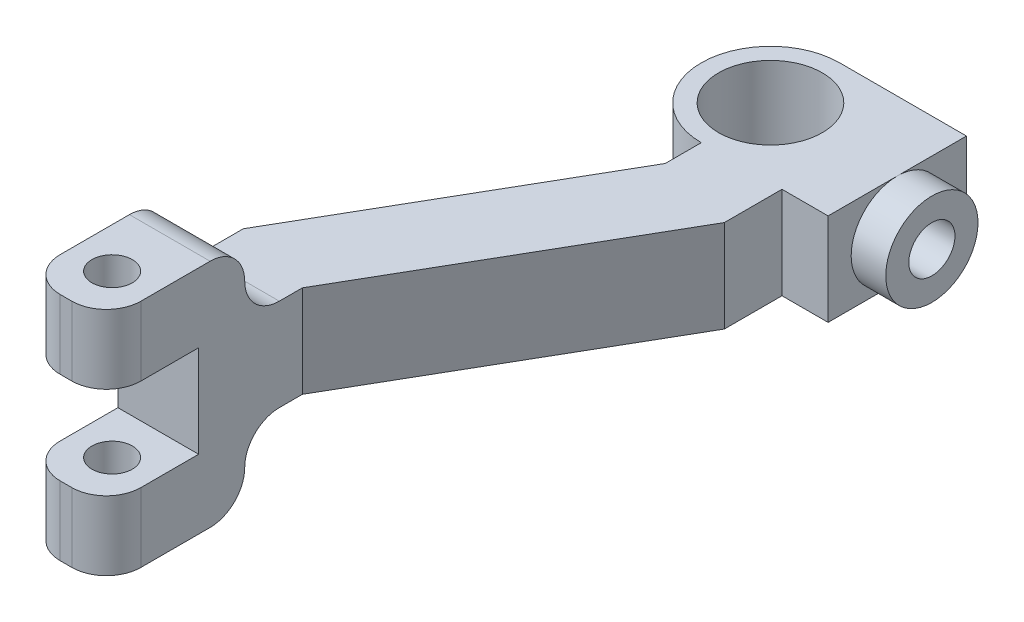
from build123d import *

# Parameters (mm, degrees)
SKETCH1_R           = 4.5
BOSS_EXTRUDE1_DEPTH = 8
SKETCH2_R           = 4
BOSS_EXTRUDE2_DEPTH = 3
SKETCH3_R           = 2
CUT_EXTRUDE1_DEPTH  = 5
BOSS_EXTRUDE3_DEPTH = 8
SKETCH5_W           = 7
SKETCH5_H           = 20
BOSS_EXTRUDE4_DEPTH = 12
FILLET1_START       = -13.395559342
FILLET1_DEPTH       = 7
FILLET1_2_DEPTH     = 7
SKETCH6_W           = 7
SKETCH6_H           = 8
CUT_EXTRUDE2_DEPTH  = 8
FILLET2_R           = 3
SKETCH7_R           = 1.75
CUT_EXTRUDE3_DEPTH  = 57.724097483


with BuildPart() as part:
    # Sketch1 → Boss-Extrude1 (new body)
    with BuildSketch(Plane(origin=(0, 0, 0), x_dir=(1, 0, 0), z_dir=(0, 1, 0))):
        with BuildLine():
            Line((0, 6), (11, 6))
            Line((11, 6), (11, -6))
            Line((11, -6), (0, -6))
            ThreePointArc((0, -6), (-6, 0), (0, 6))
        make_face()
        with Locations(Location((0, 0, 0), (0, 0, 270))):
            Circle(SKETCH1_R, mode=Mode.SUBTRACT)
    extrude(amount=BOSS_EXTRUDE1_DEPTH)

    # Sketch2 → Boss-Extrude2 (add)
    with BuildSketch(Plane(origin=(11, 0, 0), x_dir=(0, 0, -1), z_dir=(1, 0, 0))):
        with Locations(Location((0, 4, 0), (0, 0, 270))):
            Circle(SKETCH2_R)
    extrude(amount=BOSS_EXTRUDE2_DEPTH)

    # Sketch3 → Cut-Extrude1 (cut)
    with BuildSketch(Plane(origin=(14, 0, 0), x_dir=(0, 0, -1), z_dir=(1, 0, 0))):
        with Locations((0, 4)):
            Circle(SKETCH3_R)
    extrude(amount=-CUT_EXTRUDE1_DEPTH, mode=Mode.SUBTRACT)

    # Sketch4 → Boss-Extrude3 (add)
    with BuildSketch(Plane(origin=(0, 0, 0), x_dir=(1, 0, 0), z_dir=(0, 1, 0))):
        Polygon((0, -6), (0, -9.124355653), (-13.395559342, -32.326145029), (-13.395559342, -39.201789376), (-6.395559342, -39.201789376), (-6.395559342, -34.201789376), (7, -11), (7, -6), align=None)
    extrude(amount=BOSS_EXTRUDE3_DEPTH)

    # Sketch5 → Boss-Extrude4 (add)
    with BuildSketch(Plane.XY.offset(39.201789376)):
        with Locations((-9.895559342, 4)):
            Rectangle(SKETCH5_W, SKETCH5_H)
    extrude(amount=BOSS_EXTRUDE4_DEPTH)

    # Fillet1: read off the stored shape, not the designer's step
    # Fillet1 outline → Fillet1 (cut)
    with BuildSketch(Plane.YZ.offset(FILLET1_START)):
        with BuildLine():
            Line((-6, 39.201789376), (-3, 39.201789376))
            ThreePointArc((-3, 39.201789376), (-5.121320344, 40.080469032), (-6, 42.201789376))
            Line((-6, 42.201789376), (-6, 39.201789376))
        make_face()
        with BuildLine():
            ThreePointArc((14, 42.201789376), (13.121320344, 40.080469032), (11, 39.201789376))
            Line((11, 39.201789376), (14, 39.201789376))
            Line((14, 39.201789376), (14, 42.201789376))
        make_face()
    extrude(amount=FILLET1_DEPTH, mode=Mode.SUBTRACT)

    # Fillet1 2 outline → Fillet1 2 (add)
    with BuildSketch(Plane.YZ.offset(FILLET1_START)):
        with BuildLine():
            ThreePointArc((-3, 39.201789376), (-0.878679657, 38.32310972), (0, 36.201789376))
            Line((0, 36.201789376), (0, 39.201789376))
            Line((0, 39.201789376), (-3, 39.201789376))
        make_face()
        with BuildLine():
            ThreePointArc((8, 36.201789376), (8.878679656, 38.32310972), (11, 39.201789376))
            Line((11, 39.201789376), (8, 39.201789376))
            Line((8, 39.201789376), (8, 36.201789376))
        make_face()
    extrude(amount=FILLET1_2_DEPTH)

    # Sketch6 → Cut-Extrude2 (cut)
    with BuildSketch(Plane.XY.offset(51.201789376)):
        with Locations((-9.895559342, 4)):
            Rectangle(SKETCH6_W, SKETCH6_H)
    extrude(amount=-CUT_EXTRUDE2_DEPTH, mode=Mode.SUBTRACT)

    # Fillet2
    fillet2_edges = [part.edges().sort_by_distance(p)[0] for p in [
        (-6.395559342, -3, 51.201789376),
        (-13.395559342, 11, 51.201789376),
        (-6.395559342, 11, 51.201789376),
        (-13.395559342, -3, 51.201789376),
    ]]
    fillet(fillet2_edges, radius=FILLET2_R)

    # Sketch7 → Cut-Extrude3 (cut, through all)
    with BuildSketch(Plane(origin=(0, 14, 0), x_dir=(1, 0, 0), z_dir=(0, 1, 0))):
        with Locations(Location((-9.895559342, -47.201789376, 0), (0, 0, 180))):
            Circle(SKETCH7_R)
    extrude(amount=-CUT_EXTRUDE3_DEPTH, mode=Mode.SUBTRACT)


solid = part.part
